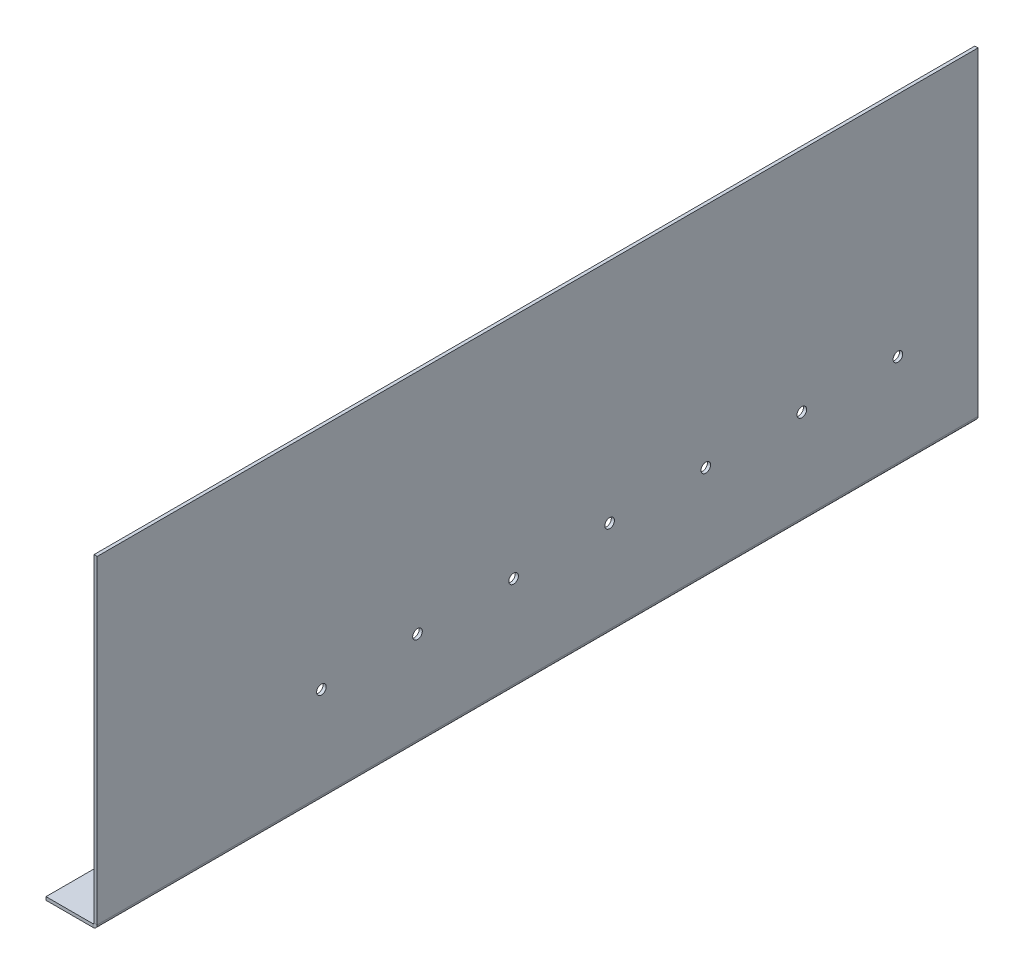
from build123d import *

# Parameters (mm, degrees)
BASE_FLANGE1_DEPTH = 550
SKETCH10_R         = 3
CUT_EXTRUDE2_DEPTH = 10


# Sheet-metal steps are written as plain solids
with BuildPart() as part:
    # Sketch1 → Base-Flange1 (new body)
    with BuildSketch(Plane.XY):
        with BuildLine():
            Line((0, 0), (29.2634, 0))
            ThreePointArc((29.2634, 0), (29.784254855, 0.215745145), (30, 0.7366))
            Line((30, 0.7366), (30, 200))
            Line((30, 200), (32, 200))
            Line((32, 200), (32, 0.7366))
            ThreePointArc((32, 0.7366), (31.198468417, -1.198468417), (29.2634, -2))
            Line((29.2634, -2), (0, -2))
            Line((0, -2), (0, 0))
        make_face()
    extrude(amount=BASE_FLANGE1_DEPTH)

    # Sketch10 → Cut-Extrude2 (cut)
    with BuildSketch(Plane(origin=(32, 0, 0), x_dir=(0, 0, -1), z_dir=(1, 0, 0))):
        with Locations((-50, 58)):
            Circle(SKETCH10_R)
        with Locations((-110, 58)):
            Circle(SKETCH10_R)
        with Locations((-170, 58)):
            Circle(SKETCH10_R)
        with Locations((-230, 58)):
            Circle(SKETCH10_R)
        with Locations((-290, 58)):
            Circle(SKETCH10_R)
        with Locations((-350, 58)):
            Circle(SKETCH10_R)
        with Locations((-410, 58)):
            Circle(SKETCH10_R)
    extrude(amount=-CUT_EXTRUDE2_DEPTH, mode=Mode.SUBTRACT)


solid = part.part
